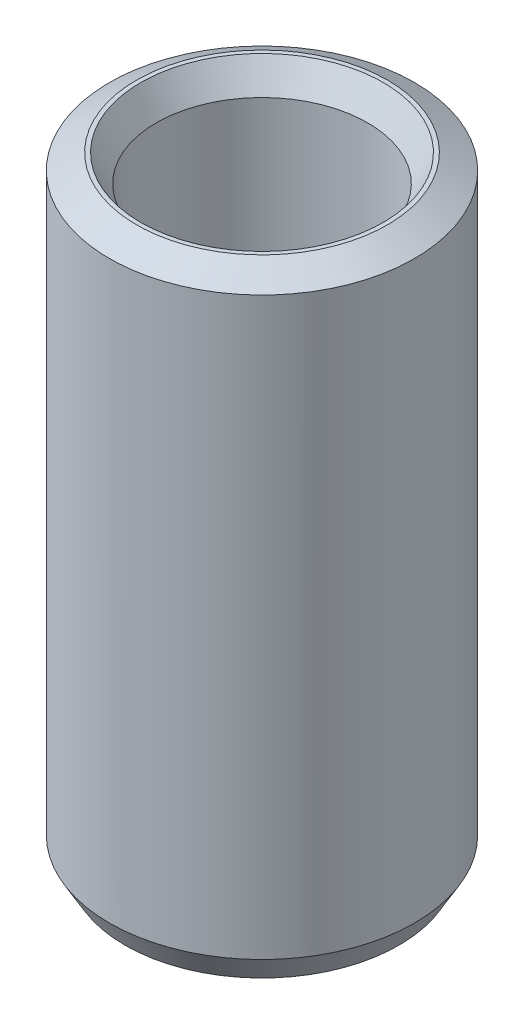
from build123d import *
from OCP.BRepFilletAPI import BRepFilletAPI_MakeChamfer

# Parameters (mm, degrees)
SKETCH1_R           = 30
BOSS_EXTRUDE1_DEPTH = 121.594950692
SKETCH2_R           = 20.775715781
CUT_EXTRUDE1_DEPTH  = 129.784051939
CHAMFER1_SIZE       = 3.074945018
CHAMFER1_SIZE2      = 5.325961002


with BuildPart() as part:
    # Sketch1 → Boss-Extrude1 (new body)
    with BuildSketch(Plane(origin=(0, 0, 0), x_dir=(1, 0, 0), z_dir=(0, 1, 0))):
        Circle(SKETCH1_R)
    extrude(amount=BOSS_EXTRUDE1_DEPTH)

    # Sketch2 → Cut-Extrude1 (cut, through all)
    with BuildSketch(Plane(origin=(0, 0, 0), x_dir=(1, 0, 0), z_dir=(0, 1, 0))):
        Circle(SKETCH2_R)
    extrude(amount=CUT_EXTRUDE1_DEPTH, mode=Mode.SUBTRACT)

    # Chamfer1: one chamfer whose edges measure the first distance from different faces: ONE call of the kernel's chamfer builder (chamfer() names one face for all edges)
    chamfer1_edges_1 = [part.edges().sort_by_distance(p)[0] for p in [
        (-20.775715781, 121.594950692, 0),
    ]]
    chamfer1_side_1 = [part.faces().sort_by_distance(p)[0] for p in [
        (-29.151471863, 121.594950692, 0),
    ]]
    chamfer1_edges_2 = [part.edges().sort_by_distance(p)[0] for p in [
        (-20.775715781, 0, 0),
    ]]
    chamfer1_side_2 = [part.faces().sort_by_distance(p)[0] for p in [
        (-20.775715781, 60.797475346, 0),
    ]]
    chamfer1_edges_3 = [part.edges().sort_by_distance(p)[0] for p in [
        (-30, 0, 0),
    ]]
    chamfer1_side_3 = [part.faces().sort_by_distance(p)[0] for p in [
        (-29.151471863, 0, 0),
    ]]
    chamfer1_edges_4 = [part.edges().sort_by_distance(p)[0] for p in [
        (-30, 121.594950692, 0),
    ]]
    chamfer1_side_4 = [part.faces().sort_by_distance(p)[0] for p in [
        (-30, 60.797475346, 0),
    ]]
    chamfer1 = BRepFilletAPI_MakeChamfer(part.part.solid().wrapped)
    for e in chamfer1_edges_1:
        chamfer1.Add(CHAMFER1_SIZE, CHAMFER1_SIZE2, e.wrapped, chamfer1_side_1[0].wrapped)  # the first distance lies on this face
    for e in chamfer1_edges_2:
        chamfer1.Add(CHAMFER1_SIZE, CHAMFER1_SIZE2, e.wrapped, chamfer1_side_2[0].wrapped)  # the first distance lies on this face
    for e in chamfer1_edges_3:
        chamfer1.Add(CHAMFER1_SIZE, CHAMFER1_SIZE2, e.wrapped, chamfer1_side_3[0].wrapped)  # the first distance lies on this face
    for e in chamfer1_edges_4:
        chamfer1.Add(CHAMFER1_SIZE, CHAMFER1_SIZE2, e.wrapped, chamfer1_side_4[0].wrapped)  # the first distance lies on this face
    add(Compound.cast(chamfer1.Shape()), mode=Mode.REPLACE)


solid = part.part
